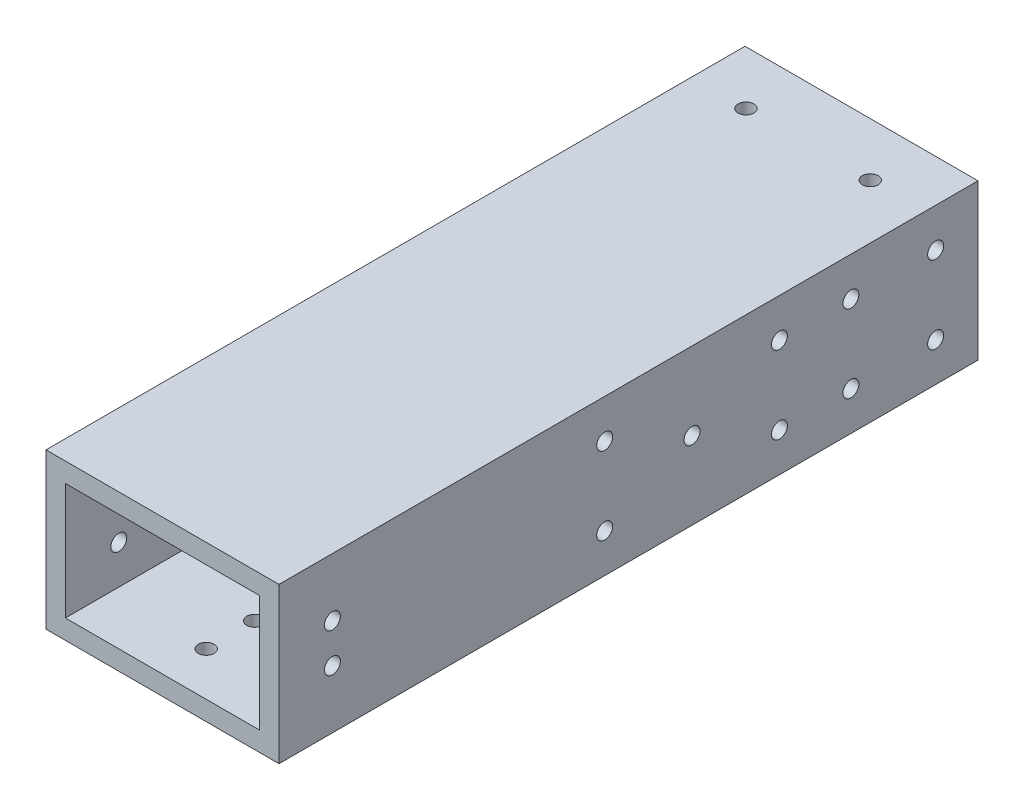
from build123d import *

# Parameters (mm, degrees)
BOSS_EXTRUDE1_DEPTH      = 152.4
BOSS_EXTRUDE1_DEPTH_BACK = 76.2
SKETCH1_W                = 76.2
SKETCH1_H                = 50.8
SKETCH1_W_2              = 63.5
SKETCH1_H_2              = 38.1
CUT_EXTRUDE1_DEPTH       = 804.658803572
CUT_EXTRUDE1_DEPTH_BACK  = 804.658803572
SKETCH2_R                = 2.6035
SKETCH2_R_2              = 2.603499999
SKETCH3_R                = 2.6035
CUT_EXTRUDE2_DEPTH       = 807.363629238
SKETCH4_R                = 2.6035
CUT_EXTRUDE3_DEPTH       = 166.1
CUT_EXTRUDE4_REACH       = 167.1
SKETCH5_R                = 2.6035


with BuildPart() as part:
    # Sketch1 → Boss-Extrude1 (new, two sides: drawn at the far end of the back side and taken through both)
    with BuildSketch(Plane.XY.offset(-BOSS_EXTRUDE1_DEPTH_BACK)):
        with Locations((0, 762.756140976)):
            Rectangle(SKETCH1_W, SKETCH1_H)
        with Locations((0, 762.756140976)):
            Rectangle(SKETCH1_W_2, SKETCH1_H_2, mode=Mode.SUBTRACT)
    extrude(amount=BOSS_EXTRUDE1_DEPTH + BOSS_EXTRUDE1_DEPTH_BACK)

    # Sketch2 → Cut-Extrude1 (cut, two sides: drawn at the far end of the back side and taken through both)
    with BuildSketch(Plane(origin=(0, 0, 0), x_dir=(0, 0, -1), z_dir=(1, 0, 0)).offset(-CUT_EXTRUDE1_DEPTH_BACK)):
        with Locations((62.346011746, 750.056140976)):
            Circle(SKETCH2_R)
        with Locations((34.638035237, 750.056140976)):
            Circle(SKETCH2_R)
        with Locations((34.638035237, 775.456140976)):
            Circle(SKETCH2_R)
        with Locations((62.346011746, 775.456140976)):
            Circle(SKETCH2_R)
        with Locations((11.259046982, 750.056140976)):
            Circle(SKETCH2_R_2)
        with Locations((11.259046982, 775.456140976)):
            Circle(SKETCH2_R_2)
        with Locations((-17.315953018, 762.756140976)):
            Circle(SKETCH2_R_2)
        with Locations((-45.890953018, 775.456140976)):
            Circle(SKETCH2_R_2)
        with Locations((-45.890953018, 750.056140976)):
            Circle(SKETCH2_R_2)
    extrude(amount=CUT_EXTRUDE1_DEPTH + CUT_EXTRUDE1_DEPTH_BACK, mode=Mode.SUBTRACT)

    # Sketch3 → Cut-Extrude2 (cut, through all)
    with BuildSketch(Plane(origin=(38.1, 0, 0), x_dir=(0, 0, -1), z_dir=(1, 0, 0))):
        with Locations((-134.9375, 769.106140976)):
            Circle(SKETCH3_R)
        with Locations((-134.9375, 756.406140976)):
            Circle(SKETCH3_R)
    extrude(amount=-CUT_EXTRUDE2_DEPTH, mode=Mode.SUBTRACT)

    # Sketch4 → Cut-Extrude3 (cut, through all)
    with BuildSketch(Plane(origin=(0, 788.156140976, 0), x_dir=(1, 0, 0), z_dir=(0, 1, 0))):
        with Locations((20.32, 58.7375)):
            Circle(SKETCH4_R)
        with Locations((-20.32, 58.7375)):
            Circle(SKETCH4_R)
    extrude(amount=-CUT_EXTRUDE3_DEPTH, mode=Mode.SUBTRACT)

    # Sketch5 → Cut-Extrude4 (cut, up to next)
    with BuildSketch(Plane.XZ.offset(-737.356140976), mode=Mode.PRIVATE) as cut_extrude4_sk1:
        with Locations((0, 138.1125)):
            Circle(SKETCH5_R)
    cut_extrude4_tool1 = extrude(cut_extrude4_sk1.sketch, amount=-CUT_EXTRUDE4_REACH, mode=Mode.PRIVATE) & part.part
    # Sketch5 → Cut-Extrude4 (cut, up to next)
    with BuildSketch(Plane.XZ.offset(-737.356140976), mode=Mode.PRIVATE) as cut_extrude4_sk2:
        with Locations((0, 122.2375)):
            Circle(SKETCH5_R)
    cut_extrude4_tool2 = extrude(cut_extrude4_sk2.sketch, amount=-CUT_EXTRUDE4_REACH, mode=Mode.PRIVATE) & part.part
    add(cut_extrude4_tool1.solids().sort_by_distance((0, 737.356141, 138.1125))[0], mode=Mode.SUBTRACT)
    add(cut_extrude4_tool2.solids().sort_by_distance((0, 737.356141, 122.2375))[0], mode=Mode.SUBTRACT)


solid = part.part
